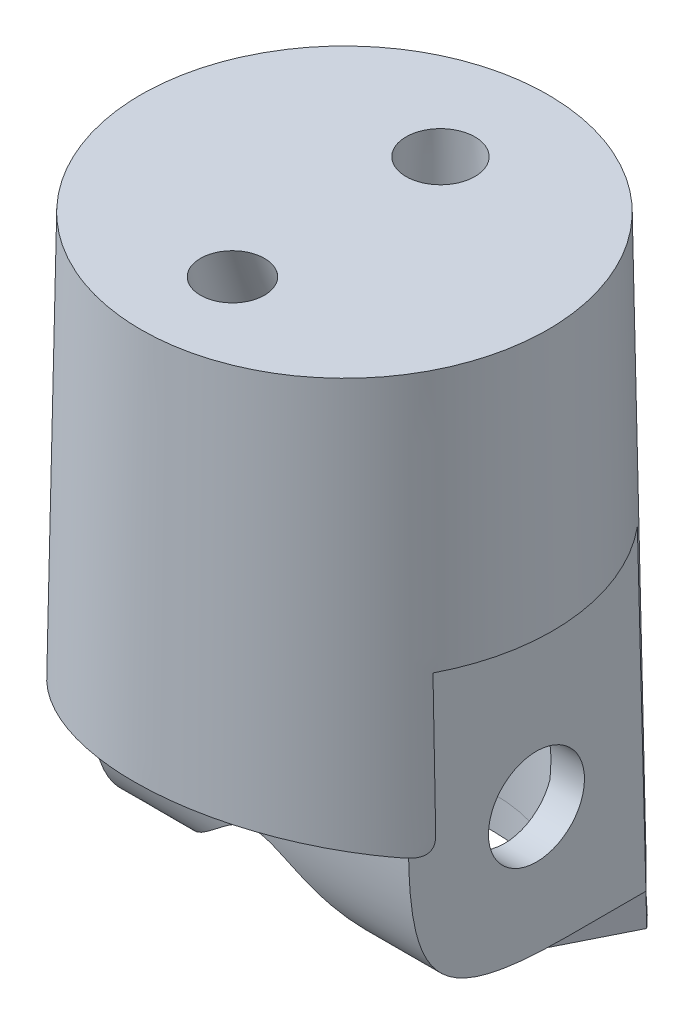
from build123d import *
from build123d.topology import SkipClean

# Parameters (mm, degrees)
SKETCH1_R                     = 6.5
BOSS_EXTRUDE1_DEPTH           = 18
BOSS_EXTRUDE1_TAPER           = 1
BOSS_EXTRUDE1_OTHER_WAY_DEPTH = 10
BOSS_EXTRUDE1_OTHER_WAY_TAPER = -1
SKETCH2_W                     = 5.545055897
SKETCH2_H                     = 10
CUT_EXTRUDE1_DEPTH            = 22.497594206
CUT_EXTRUDE2_DEPTH            = 23.378552983
CUT_EXTRUDE2_DEPTH_BACK       = 23.378552983
CUT_EXTRUDE3_DEPTH            = 23.378552983
CUT_EXTRUDE3_DEPTH_BACK       = 23.378552983
SKETCH4_R                     = 1.5
FILLET1_SIZE                  = 5
CUT_EXTRUDE4_DEPTH            = 21.268192633
CUT_EXTRUDE4_DEPTH_BACK       = 21.268192633
SKETCH5_W                     = 18.469746175
SKETCH5_H                     = 12.695602453
CUT_EXTRUDE5_DEPTH            = 10
BOSS_EXTRUDE3_DEPTH           = 1
BOSS_EXTRUDE3_DRAFT           = -1
SKETCH11_R                    = 1.5
CUT_EXTRUDE7_DEPTH            = 15.423347107
CUT_EXTRUDE7_DRAFT            = -3
SKETCH12_R                    = 1.5
SKETCH13_R                    = 1


with BuildPart() as part:
    # Sketch1 → Boss-Extrude1 (new body)
    with BuildSketch(Plane(origin=(0, 0, 0), x_dir=(1, 0, 0), z_dir=(0, 1, 0))):
        Circle(SKETCH1_R)
    extrude(amount=BOSS_EXTRUDE1_DEPTH, taper=BOSS_EXTRUDE1_TAPER)

    # Sketch1 → Boss-Extrude1 other way (add)
    with BuildSketch(Plane(origin=(0, 0, 0), x_dir=(1, 0, 0), z_dir=(0, 1, 0))):
        Circle(SKETCH1_R)
    extrude(amount=-BOSS_EXTRUDE1_OTHER_WAY_DEPTH, taper=BOSS_EXTRUDE1_OTHER_WAY_TAPER)

    # Sketch2 → Cut-Extrude1 (cut, through all)
    with BuildSketch(Plane.XY.offset(3)):
        with Locations((-7.772527949, -5)):
            Rectangle(SKETCH2_W, SKETCH2_H)
        with Locations((7.772527949, -5)):
            Rectangle(SKETCH2_W, SKETCH2_H)
    extrude(amount=-CUT_EXTRUDE1_DEPTH, mode=Mode.SUBTRACT)

    # Sketch3 → Cut-Extrude2 (cut, two sides: drawn at the far end of the back side and taken through both)
    with BuildSketch(Plane(origin=(5, 0, 0), x_dir=(0, 0, -1), z_dir=(1, 0, 0)).offset(-CUT_EXTRUDE2_DEPTH_BACK)):
        Polygon((-3, -10), (-3, -5), (-18.921941618, -0.733728602), (-18.921941618, -10), align=None)
    extrude(amount=CUT_EXTRUDE2_DEPTH + CUT_EXTRUDE2_DEPTH_BACK, mode=Mode.SUBTRACT)

    # Sketch4 → Cut-Extrude3 (cut, two sides: drawn at the far end of the back side and taken through both)
    with BuildSketch(Plane(origin=(5, 0, 0), x_dir=(0, 0, -1), z_dir=(1, 0, 0)).offset(-CUT_EXTRUDE3_DEPTH_BACK)):
        with Locations(Location((1, -6, 0), (0, 0, 270))):
            Circle(SKETCH4_R)
    extrude(amount=CUT_EXTRUDE3_DEPTH + CUT_EXTRUDE3_DEPTH_BACK, mode=Mode.SUBTRACT)

    # Fillet1
    # a fillet whose section is not a circle: 5 mm, written as the material it takes off along each edge
    with BuildSketch(Plane(origin=(17.5, -10, 3), x_dir=(0, 0, -1), z_dir=(-1, 0, 0))) as fillet1_piece_1:
        with BuildLine():
            Bezier((FILLET1_SIZE, 0), (0, 0), (0, -FILLET1_SIZE), weights=[1, 1.5, 1])
            Line((0, -FILLET1_SIZE), (0, 0))
            Line((0, 0), (FILLET1_SIZE, 0))
        make_face()
    extrude(amount=35, mode=Mode.SUBTRACT)

    # Fillet2
    # a fillet whose section is not a circle: 10, 5 mm, written as the material it takes off along each edge
    with BuildSketch(Plane(origin=(0, 18, 0), x_dir=(1, 0, 0), z_dir=(0, 0, -1))) as fillet2_piece_1:
        with BuildLine():
            Bezier((6.358836316, 9.912737968), (6.185808831, 0), (1.35959784, 0), weights=[1, 0.818181818, 1])
            Line((1.35959784, 0), (6.185808831, 0))
            Line((6.185808831, 0), (6.358836316, 9.912737968))
        make_face()
    revolve(axis=Axis((0, 18, 0), (0, -1, 0)), mode=Mode.SUBTRACT)

    # Sketch5 → Cut-Extrude4 (cut, two sides: drawn at the far end of the back side and taken through both)
    with BuildSketch(Plane(origin=(0, 0, 0), x_dir=(0, 0, -1), z_dir=(1, 0, 0)).offset(-CUT_EXTRUDE4_DEPTH_BACK)):
        with Locations((0.914582981, 14.435063259)):
            Rectangle(SKETCH5_W, SKETCH5_H)
    extrude(amount=CUT_EXTRUDE4_DEPTH + CUT_EXTRUDE4_DEPTH_BACK, mode=Mode.SUBTRACT)

    # Sketch6 → Cut-Extrude5 (cut)
    with BuildSketch(Plane.XZ.offset(10)):
        with BuildLine():
            Line((-4, -2.418971635), (-4, 0.581028365))
            ThreePointArc((-4, 0.581028365), (0, 2.836607379), (4, 0.581028365))
            Line((4, 0.581028365), (4, -2.418971635))
            ThreePointArc((4, -2.418971635), (0, -4.674550649), (-4, -2.418971635))
        make_face()
    extrude(amount=-CUT_EXTRUDE5_DEPTH, mode=Mode.SUBTRACT)

    # Fillet3
    # a fillet whose section is not a circle: 0.5 mm, written as the material it takes off along each edge
    with BuildSketch(Plane(origin=(5, -5, 3), x_dir=(0, 1, 0), z_dir=(1, 0, 0))) as fillet3_piece_1:
        with BuildLine():
            Bezier((0.651612686, 0), (0, 0), (0.168649773, 0.629409523), weights=[1, 1, 1])
            Line((0.168649773, 0.629409523), (0, 0))
            Line((0, 0), (0.651612686, 0))
        make_face()
    extrude(amount=2.493517729, mode=Mode.SUBTRACT)
    with BuildSketch(Plane(origin=(-7.493517729, -5, 3), x_dir=(0, 0.258819045102518, 0.9659258262890691), z_dir=(1, 0, 0))) as fillet3_piece_2:
        with BuildLine():
            Bezier((0.651612686, 0), (0, 0), (0.168649773, -0.629409523), weights=[1, 1, 1])
            Line((0.168649773, -0.629409523), (0, 0))
            Line((0, 0), (0.651612686, 0))
        make_face()
    extrude(amount=2.493517729, mode=Mode.SUBTRACT)


with BuildPart() as boss_extrude3_tool:
    # Sketch9 → Boss-Extrude3 (with draft: the straight prism first)
    with BuildSketch(Plane.XZ.offset(10)):
        with BuildLine():
            Line((-4, -2.418971635), (-5, -4.421495943))
            ThreePointArc((-5, -4.421495943), (0, -6.674550649), (5, -4.421495943))
            Line((5, -4.421495943), (4, -2.418971635))
            ThreePointArc((4, -2.418971635), (0, -4.674550649), (-4, -2.418971635))
        make_face()
    extrude(amount=BOSS_EXTRUDE3_DEPTH)
    # Boss-Extrude3: the draft: its side faces are tilted about the plane it starts from
    boss_extrude3_sides = [boss_extrude3_tool.faces().sort_by_distance(p)[0] for p in [
        (0, -10.5, -6.674550649),
        (4.5, -10.5, -3.420233789),
        (0, -10.5, -4.674550649),
        (-4.5, -10.5, -3.420233789),
    ]]
    draft(boss_extrude3_sides, Plane.XZ.offset(10), BOSS_EXTRUDE3_DRAFT)


with BuildPart() as part_1:
    add(part.part)

    # Boss-Extrude3: add boss_extrude3_tool
    add(boss_extrude3_tool.part)


with BuildPart() as cut_extrude7_tool:
    # Sketch11 → Cut-Extrude7 (with draft: the straight prism first)
    with BuildSketch(Plane.XZ):
        with Locations((0, -3)):
            Circle(SKETCH11_R)
    extrude(amount=-CUT_EXTRUDE7_DEPTH)
    # Cut-Extrude7: the draft: its side faces are tilted about the plane it starts from
    cut_extrude7_sides = [cut_extrude7_tool.faces().sort_by_distance(p)[0] for p in [
        (-1.5, 7.711673554, -3),
    ]]
    draft(cut_extrude7_sides, Plane.XZ, CUT_EXTRUDE7_DRAFT)


with BuildPart() as part_2:
    add(part_1.part)

    # Cut-Extrude7: cut by cut_extrude7_tool
    add(cut_extrude7_tool.part, mode=Mode.SUBTRACT)

    # Sketch12 → Cut-Loft1 section 0
    with SkipClean():  # the faces are left unmerged after this step: merging them gives an invalid solid
        with BuildSketch(Plane.XZ):
            with Locations((0, 1)):
                Circle(SKETCH12_R)
        # Sketch13 → Cut-Loft1 section 1
        with BuildSketch(Plane(origin=(0, 8.087262032, 0), x_dir=(1, 0, 0), z_dir=(0, 1, 0))):
            with Locations((0, -3.5)):
                Circle(SKETCH13_R)
        loft(mode=Mode.SUBTRACT)


solid = part_2.part
